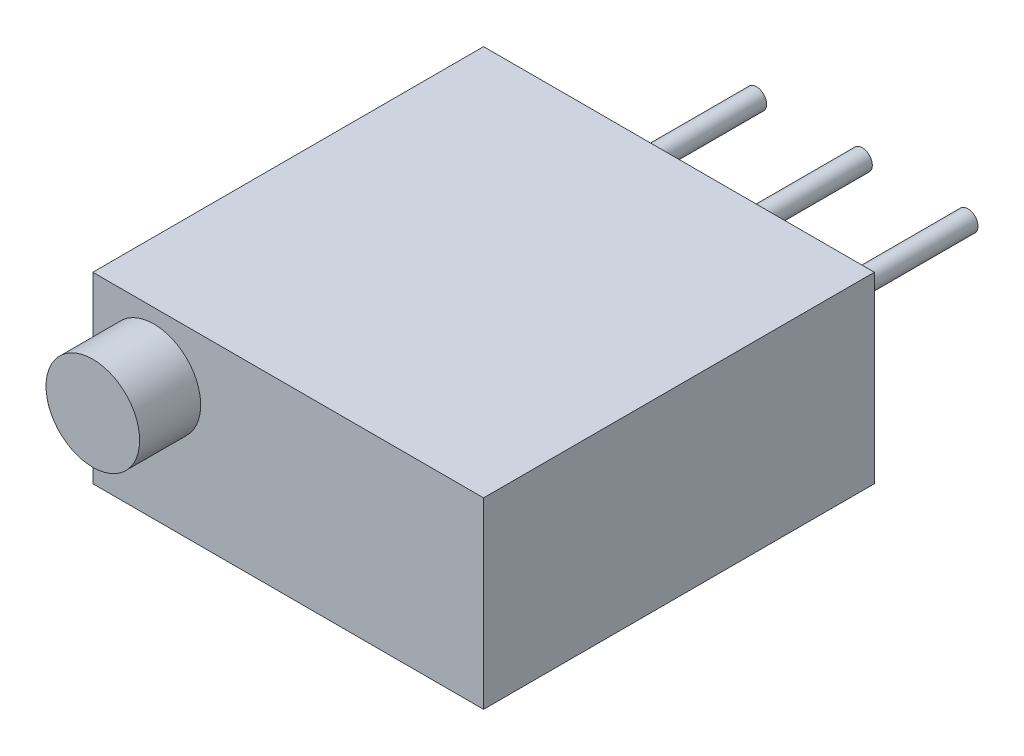
from build123d import *

# Parameters (mm, degrees)
SKETCH_1_W      = 9.6
SKETCH_1_H      = 9.6
EXTRUDE_1_DEPTH = 4.5
SKETCH_3_R      = 0.25
EXTRUDE_3_DEPTH = 4.5
SKETCH_4_R      = 1.15
EXTRUDE_4_DEPTH = 1.5


with BuildPart() as part:
    # 草图1 → 拉伸1 (new body)
    with BuildSketch(Plane(origin=(0, 0, 0), x_dir=(1, 0, 0), z_dir=(0, 1, 0))):
        Rectangle(SKETCH_1_W, SKETCH_1_H)
    extrude(amount=EXTRUDE_1_DEPTH)

    # 草图3 → 拉伸3 (add)
    with BuildSketch(Plane(origin=(0, 0, -4.8), x_dir=(-1, 0, 0), z_dir=(0, 0, -1))):
        with Locations((0, 2.25)):
            Circle(SKETCH_3_R)
        with Locations((2.595978382, 2.25)):
            Circle(SKETCH_3_R)
        with Locations((-2.595978382, 2.25)):
            Circle(SKETCH_3_R)
    extrude(amount=EXTRUDE_3_DEPTH)

    # 草图4 → 拉伸4 (add)
    with BuildSketch(Plane.XY.offset(4.8)):
        with Locations((-3.3, 3)):
            Circle(SKETCH_4_R)
    extrude(amount=EXTRUDE_4_DEPTH)


solid = part.part
